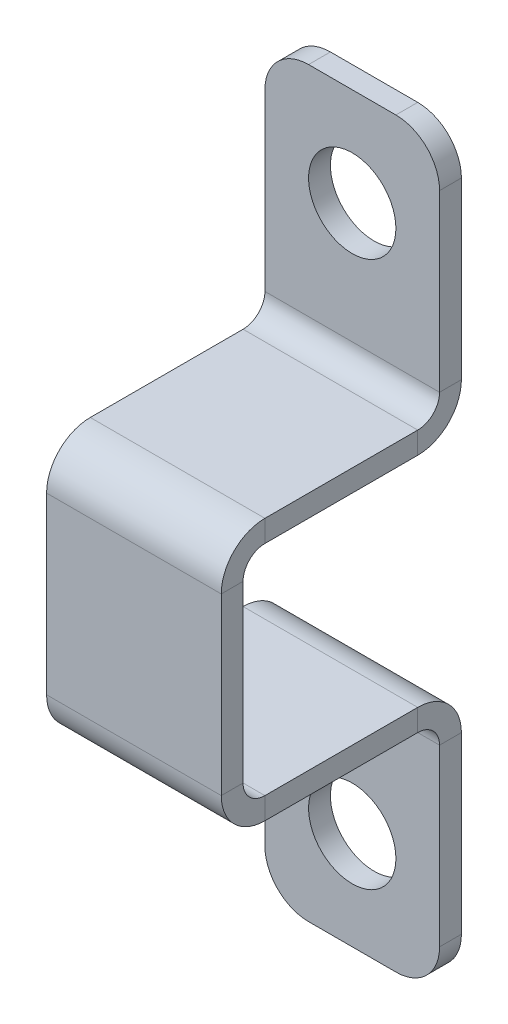
from build123d import *

# Parameters (mm, degrees)
SKETCH_3_W                         = 8
SKETCH_3_H                         = 10
SM_BASE_FLANGE_1_DEPTH             = 1
SM_EDGE_FLANGE_1_STRIP_W           = 6
SM_EDGE_FLANGE_1_STRIP_H           = 1
SM_EDGE_FLANGE_1_STRIP_CUT_DEPTH   = 8
SM_EDGE_FLANGE_1_STRIP_2_W         = 6
SM_EDGE_FLANGE_1_STRIP_2_H         = 1
SM_EDGE_FLANGE_1_STRIP_CUT_2_DEPTH = 8
SM_EDGE_FLANGE_1_DEPTH             = 8
SM_EDGE_FLANGE_1_BEND_DEPTH        = 8
SM_EDGE_FLANGE_2_STRIP_W           = 6
SM_EDGE_FLANGE_2_STRIP_H           = 1
SM_EDGE_FLANGE_2_STRIP_CUT_DEPTH   = 8
SM_EDGE_FLANGE_2_DEPTH             = 8
SM_EDGE_FLANGE_3_STRIP_W           = 6
SM_EDGE_FLANGE_3_STRIP_H           = 1
SM_EDGE_FLANGE_3_STRIP_CUT_DEPTH   = 8
SM_EDGE_FLANGE_3_DEPTH             = 8
FILLET_1_R                         = 2
HOLE_WIZARD_4_0_4_1_D              = 4


# Sheet-metal steps are written as plain solids
with BuildPart() as part:
    # 草图3 → 基体-法兰1 (new body)
    with BuildSketch(Plane.XY.offset(15)):
        with Locations((62.047155018, 0)):
            Rectangle(SKETCH_3_W, SKETCH_3_H)
    extrude(amount=-SM_BASE_FLANGE_1_DEPTH)

    # 边线-法兰1 strip (across the edge) → 边线-法兰1 strip cut (cut)
    with BuildSketch(Plane(origin=(66.047155018, -5, 14), x_dir=(0, 1, 0), z_dir=(-1, 0, 0))):
        with Locations((-2, -0.5)):
            Rectangle(SM_EDGE_FLANGE_1_STRIP_W, SM_EDGE_FLANGE_1_STRIP_H)
    extrude(amount=SM_EDGE_FLANGE_1_STRIP_CUT_DEPTH, mode=Mode.SUBTRACT)

    # 边线-法兰1 strip 2 (across the edge) → 边线-法兰1 strip cut 2 (cut)
    with BuildSketch(Plane(origin=(58.047155018, 5, 14), x_dir=(0, -1, 0), z_dir=(1, 0, 0))):
        with Locations((-2, -0.5)):
            Rectangle(SM_EDGE_FLANGE_1_STRIP_2_W, SM_EDGE_FLANGE_1_STRIP_2_H)
    extrude(amount=SM_EDGE_FLANGE_1_STRIP_CUT_2_DEPTH, mode=Mode.SUBTRACT)

    # 边线-法兰1 section (across the edge) → 边线-法兰1 (add)
    with BuildSketch(Plane(origin=(66.047155018, -5, 14), x_dir=(0, 1, 0), z_dir=(-1, 0, 0))):
        with BuildLine():
            Line((-1, 1), (-1, 9))
            Line((-1, 9), (0, 9))
            Line((0, 9), (0, 1))
            ThreePointArc((0, 1), (0.292893219, 0.292893219), (1, 0))
            Line((1, 0), (1, -1))
            ThreePointArc((1, -1), (-0.414213562, -0.414213562), (-1, 1))
        make_face()
    extrude(amount=SM_EDGE_FLANGE_1_DEPTH)

    # 边线-法兰1 section 2 (across the edge) → 边线-法兰1 bend (add)
    with BuildSketch(Plane(origin=(58.047155018, 5, 14), x_dir=(0, -1, 0), z_dir=(1, 0, 0))):
        with BuildLine():
            Line((-1, 1), (-1, 9))
            Line((-1, 9), (0, 9))
            Line((0, 9), (0, 1))
            ThreePointArc((0, 1), (0.292893219, 0.292893219), (1, 0))
            Line((1, 0), (1, -1))
            ThreePointArc((1, -1), (-0.414213562, -0.414213562), (-1, 1))
        make_face()
    extrude(amount=SM_EDGE_FLANGE_1_BEND_DEPTH)

    # 边线-法兰2 strip (across the edge) → 边线-法兰2 strip cut (cut)
    with BuildSketch(Plane(origin=(58.047155018, -6, 5), x_dir=(0, 0, 1), z_dir=(1, 0, 0))):
        with Locations((-2, -0.5)):
            Rectangle(SM_EDGE_FLANGE_2_STRIP_W, SM_EDGE_FLANGE_2_STRIP_H)
    extrude(amount=SM_EDGE_FLANGE_2_STRIP_CUT_DEPTH, mode=Mode.SUBTRACT)

    # 边线-法兰2 section (across the edge) → 边线-法兰2 (add)
    with BuildSketch(Plane(origin=(58.047155018, -6, 5), x_dir=(0, 0, 1), z_dir=(1, 0, 0))):
        with BuildLine():
            Line((-1, 1), (-1, 11))
            Line((-1, 11), (0, 11))
            Line((0, 11), (0, 1))
            ThreePointArc((0, 1), (0.292893219, 0.292893219), (1, 0))
            Line((1, 0), (1, -1))
            ThreePointArc((1, -1), (-0.414213562, -0.414213562), (-1, 1))
        make_face()
    extrude(amount=SM_EDGE_FLANGE_2_DEPTH)

    # 边线-法兰3 strip (across the edge) → 边线-法兰3 strip cut (cut)
    with BuildSketch(Plane(origin=(66.047155018, 6, 5), x_dir=(0, 0, 1), z_dir=(-1, 0, 0))):
        with Locations((-2, -0.5)):
            Rectangle(SM_EDGE_FLANGE_3_STRIP_W, SM_EDGE_FLANGE_3_STRIP_H)
    extrude(amount=SM_EDGE_FLANGE_3_STRIP_CUT_DEPTH, mode=Mode.SUBTRACT)

    # 边线-法兰3 section (across the edge) → 边线-法兰3 (add)
    with BuildSketch(Plane(origin=(66.047155018, 6, 5), x_dir=(0, 0, 1), z_dir=(-1, 0, 0))):
        with BuildLine():
            Line((-1, 1), (-1, 11))
            Line((-1, 11), (0, 11))
            Line((0, 11), (0, 1))
            ThreePointArc((0, 1), (0.292893219, 0.292893219), (1, 0))
            Line((1, 0), (1, -1))
            ThreePointArc((1, -1), (-0.414213562, -0.414213562), (-1, 1))
        make_face()
    extrude(amount=SM_EDGE_FLANGE_3_DEPTH)

    # 圆角1
    fillet_1_edges = [part.edges().sort_by_distance(p)[0] for p in [
        (58.047155018, -17, 4.5),
        (66.047155018, -17, 4.5),
        (66.047155018, 17, 4.5),
        (58.047155018, 17, 4.5),
    ]]
    fillet(fillet_1_edges, radius=FILLET_1_R)

    # Ø4.0 (4) 直径孔1 (through all)
    with Locations(Plane.XY.offset(5)):
        with Locations((62.047155018, 12.5), (62.047155018, -12.5)):
            Hole(HOLE_WIZARD_4_0_4_1_D / 2)


solid = part.part
